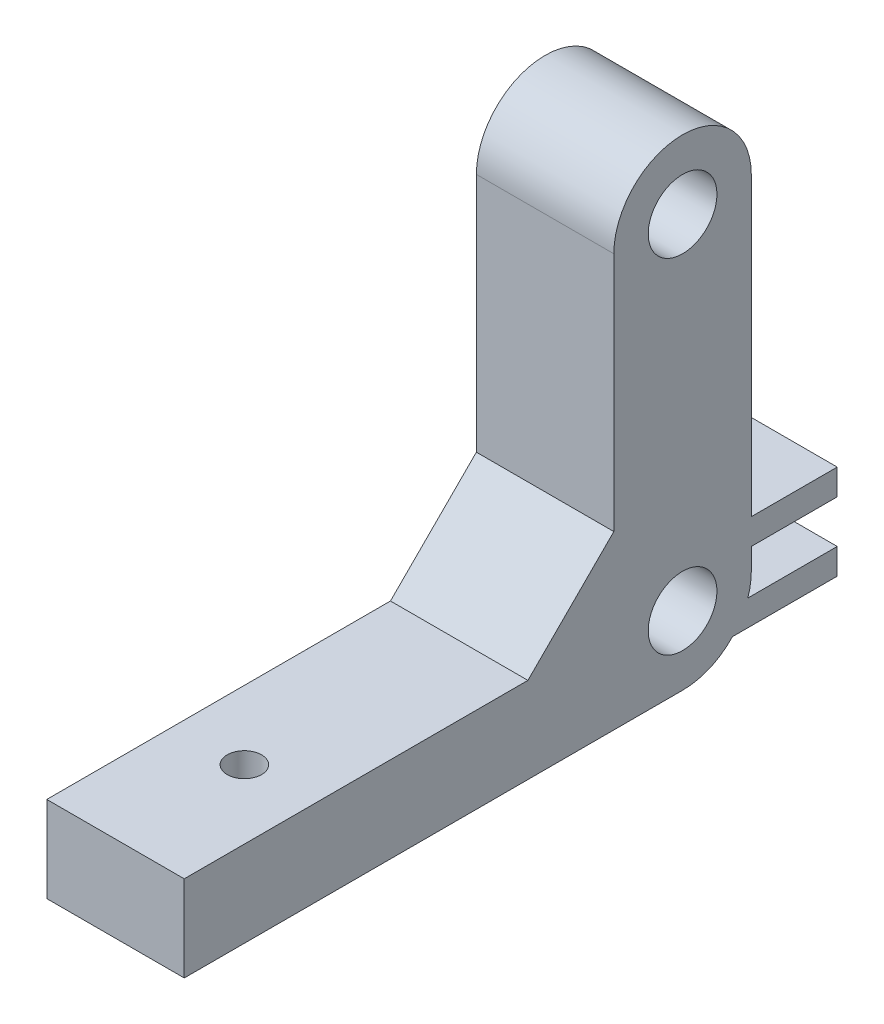
from build123d import *

# Parameters (mm, degrees)
SKETCH1_R           = 4
BOSS_EXTRUDE1_DEPTH = 16
SKETCH2_R           = 2
CUT_EXTRUDE1_DEPTH  = 77.491311533
SKETCH3_R           = 1.5
CUT_EXTRUDE2_DEPTH  = 75.439040429


with BuildPart() as part:
    # Sketch1 → Boss-Extrude1 (new body)
    with BuildSketch(Plane(origin=(0, 0, 0), x_dir=(0, 0, -1), z_dir=(1, 0, 0))):
        with BuildLine():
            Line((-10.309088451, -58.789851982), (-58.982376521, -58.789851982))
            Line((-58.982376521, -58.789851982), (-58.982376521, -48.789851982))
            Line((-58.982376521, -48.789851982), (-18.982376521, -48.789851982))
            Line((-18.982376521, -48.789851982), (-8.982376521, -38.789851982))
            Line((-8.982376521, -38.789851982), (-8.982376521, -10.789851982))
            ThreePointArc((-8.982376521, -10.789851982), (-0.982376521, -2.789851982), (7.017623479, -10.789851982))
            Line((7.017623479, -10.789851982), (7.017623479, -45.289851982))
            Line((7.017623479, -45.289851982), (17.017623479, -45.289851982))
            Line((17.017623479, -45.289851982), (17.017623479, -48.289851982))
            Line((17.017623479, -48.289851982), (7.017623479, -48.289851982))
            Line((7.017623479, -48.289851982), (7.017623479, -50.789851982))
            ThreePointArc((7.017623479, -50.789851982), (6.916823965, -52.055802887), (6.616965556, -53.289851982))
            Line((6.616965556, -53.289851982), (17.017623479, -53.289851982))
            Line((17.017623479, -53.289851982), (17.017623479, -56.289851982))
            Line((17.017623479, -56.289851982), (4.827098499, -56.289851982))
            ThreePointArc((4.827098499, -56.289851982), (2.179901139, -58.138321211), (-0.982376521, -58.789851982))
            Line((-0.982376521, -58.789851982), (-10.309088451, -58.789851982))
        make_face()
        with Locations((-0.982376521, -10.789851982)):
            Circle(SKETCH1_R, mode=Mode.SUBTRACT)
        with Locations((-0.982376521, -50.789851982)):
            Circle(SKETCH1_R, mode=Mode.SUBTRACT)
    extrude(amount=-BOSS_EXTRUDE1_DEPTH)

    # Sketch2 → Cut-Extrude1 (cut, through all)
    with BuildSketch(Plane(origin=(0, -48.789851982, 0), x_dir=(1, 0, 0), z_dir=(0, 1, 0))):
        with Locations((-8, -43.982376521)):
            Circle(SKETCH2_R)
    extrude(amount=-CUT_EXTRUDE1_DEPTH, mode=Mode.SUBTRACT)

    # Sketch3 → Cut-Extrude2 (cut, through all)
    with BuildSketch(Plane(origin=(0, -45.289851982, 0), x_dir=(1, 0, 0), z_dir=(0, 1, 0))):
        with Locations((-8, 12.017623479)):
            Circle(SKETCH3_R)
    extrude(amount=-CUT_EXTRUDE2_DEPTH, mode=Mode.SUBTRACT)


solid = part.part
